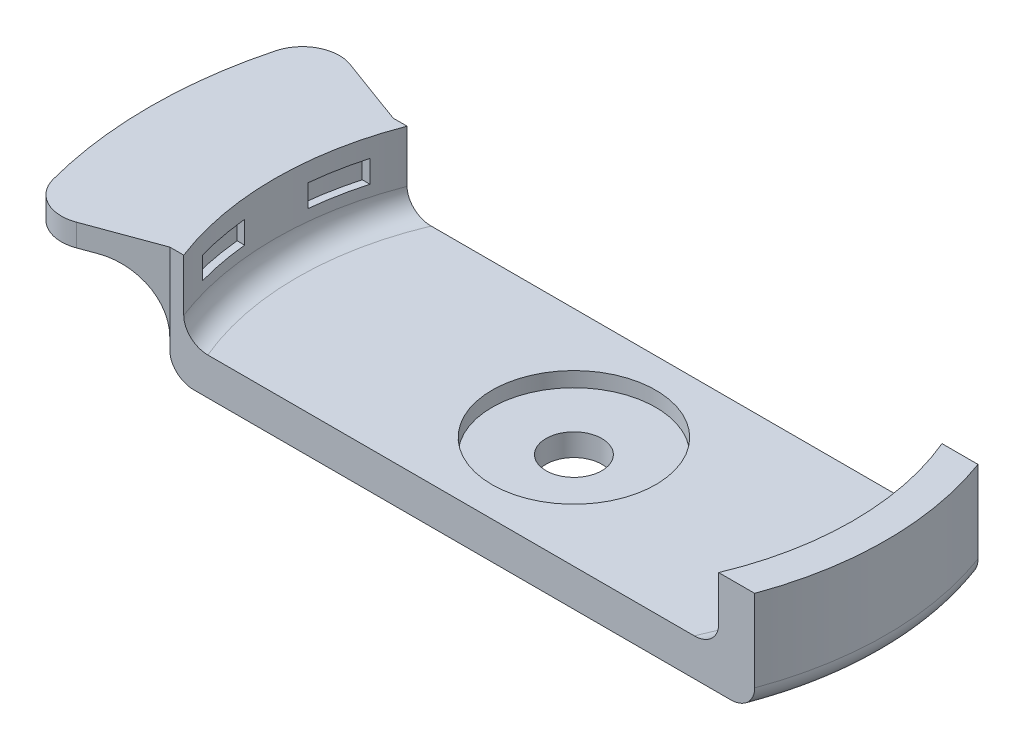
from build123d import *

# Parameters (mm, degrees)
BOSS_EXTRUDE1_DEPTH      = 8.5
CUT_EXTRUDE4_DEPTH       = 12
FILLET1_R                = 3
CUT_EXTRUDE5_DEPTH       = 46.354741112
CUT_EXTRUDE5_DEPTH_BACK  = 46.354741112
SKETCH6_W                = 4.541260622
SKETCH6_H                = 2
CUT_EXTRUDE6_START       = 1
CUT_EXTRUDE6_DEPTH       = 3
CUT_EXTRUDE7_REACH       = 47.355
CUT_EXTRUDE7_END_RADIUS  = 42.2
SKETCH8_W                = 25
SKETCH8_H                = 3
BOSS_EXTRUDE2_START      = 6.5
BOSS_EXTRUDE2_DEPTH      = 3
FILLET2_R                = 5
SKETCH10_R               = 11
CUT_EXTRUDE8_DEPTH       = 2
CUT_EXTRUDE9_REACH       = 63.124
SKETCH11_R               = 3.75
FILLET3_R                = 7.5
CUT_EXTRUDE10_DEPTH      = 61.534679882
CUT_EXTRUDE10_DEPTH_BACK = 61.534679882
SKETCH12_W               = 19.340558592
SKETCH12_H               = 3


# Read off the part's stored shape, not the designer's step: Cut-Extrude6
with BuildPart() as part:
    # Sketch1 → Boss-Extrude1 (new, symmetric)
    with BuildSketch(Plane(origin=(0, 0, 0), x_dir=(1, 0, 0), z_dir=(0, 1, 0))):
        with BuildLine():
            Line((-39.278701549, 15), (39.278701549, 15))
            ThreePointArc((39.278701549, 15), (41.95, 0), (39.278701549, -15))
            Line((39.278701549, -15), (-39.278701549, -15))
            ThreePointArc((-39.278701549, -15), (-41.95, 0), (-39.278701549, 15))
        make_face()
    extrude(amount=BOSS_EXTRUDE1_DEPTH, both=True)

    # Sketch5 → Cut-Extrude4 (cut)
    with BuildSketch(Plane(origin=(0, 8.5, 0), x_dir=(1, 0, 0), z_dir=(0, 1, 0))):
        with BuildLine():
            Line((-37.408739378, 15), (34.445827296, 15))
            ThreePointArc((34.445827296, 15), (37.45, 0), (34.445827296, -15))
            Line((34.445827296, -15), (-37.408739378, -15))
            ThreePointArc((-37.408739378, -15), (-40.2, 0), (-37.408739378, 15))
        make_face()
    extrude(amount=-CUT_EXTRUDE4_DEPTH, mode=Mode.SUBTRACT)

    # Fillet1
    fillet1_edges = [part.edges().sort_by_distance(p)[0] for p in [
        (-40.2, -3.5, 0),
        (37.45, -3.5, 0),
        (-41.95, -8.5, 0),
        (41.95, -8.5, 0),
    ]]
    fillet(fillet1_edges, radius=FILLET1_R)

    # Sketch6 → Cut-Extrude5 (cut, two sides: drawn at the far end of the back side and taken through both)
    with BuildSketch(Plane.XY.offset(-CUT_EXTRUDE5_DEPTH_BACK)):
        with Locations((-39.679369689, 7.5)):
            Rectangle(SKETCH6_W, SKETCH6_H)
    extrude(amount=CUT_EXTRUDE5_DEPTH + CUT_EXTRUDE5_DEPTH_BACK, mode=Mode.SUBTRACT)

    # Cut-Extrude6 outline → Cut-Extrude6 (cut)
    with BuildSketch(Plane(origin=(0, 0, 0), x_dir=(1, 0, 0), z_dir=(0, 1, 0)).offset(CUT_EXTRUDE6_START)):
        with BuildLine():
            ThreePointArc((-40.987968885, -4.25), (-40.485797555, -7.777069093), (-39.691352248, -11.25))
            Line((-39.691352248, -11.25), (-38.653798077, -11.25))
            ThreePointArc((-38.653798077, -11.25), (-39.468108328, -7.778438147), (-39.982857905, -4.25))
            Line((-39.982857905, -4.25), (-40.987968885, -4.25))
        make_face()
        with BuildLine():
            Line((-40.987968885, 4.25), (-39.982857905, 4.25))
            ThreePointArc((-39.982857905, 4.25), (-39.468108328, 7.778438147), (-38.653798077, 11.25))
            Line((-38.653798077, 11.25), (-39.691352248, 11.25))
            ThreePointArc((-39.691352248, 11.25), (-40.485797555, 7.777069093), (-40.987968885, 4.25))
        make_face()
    extrude(amount=CUT_EXTRUDE6_DEPTH, mode=Mode.SUBTRACT)

    # Cut-Extrude7: up to this cylinder (the profile starts inside it)
    cut_extrude7_end = Plane(origin=(-1.5, 0.5, 0), z_dir=(0, -1, 0)) * Cylinder(CUT_EXTRUDE7_END_RADIUS, 180.11, mode=Mode.PRIVATE)
    # Sketch8 → Cut-Extrude7 (cut, up to the surface)
    with BuildSketch(Plane(origin=(0, 0, 0), x_dir=(0, 0, -1), z_dir=(1, 0, 0)), mode=Mode.PRIVATE) as cut_extrude7_sk1:
        with Locations((0, 0.5)):
            Rectangle(SKETCH8_W, SKETCH8_H)
    cut_extrude7_tool1 = extrude(cut_extrude7_sk1.sketch, amount=CUT_EXTRUDE7_REACH, mode=Mode.PRIVATE) & cut_extrude7_end
    add(cut_extrude7_tool1.solids().sort_by_distance((0, 0.5, 0))[0], mode=Mode.SUBTRACT)

    # Sketch9 → Boss-Extrude2 (add)
    with BuildSketch(Plane(origin=(0, 0, 0), x_dir=(1, 0, 0), z_dir=(0, 1, 0)).offset(BOSS_EXTRUDE2_START)):
        with BuildLine():
            Line((-53.356504155, 20.178365938), (-39.278701549, 15))
            ThreePointArc((-39.278701549, 15), (-41.95, 0), (-39.278701549, -15))
            Line((-39.278701549, -15), (-53.356504155, -20.178365938))
            ThreePointArc((-53.356504155, -20.178365938), (-56.95, 0), (-53.356504155, 20.178365938))
        make_face()
    extrude(amount=-BOSS_EXTRUDE2_DEPTH)

    # Fillet2
    fillet2_edges = [part.edges().sort_by_distance(p)[0] for p in [
        (-53.356504155, 5, 20.178365938),
        (-53.356504155, 5, -20.178365938),
    ]]
    fillet(fillet2_edges, radius=FILLET2_R)

    # Sketch10 → Cut-Extrude8 (cut)
    with BuildSketch(Plane(origin=(0, -3.5, 0), x_dir=(1, 0, 0), z_dir=(0, 1, 0))):
        with Locations(Location((0, 0, 0), (0, 0, 270))):
            Circle(SKETCH10_R)
    extrude(amount=-CUT_EXTRUDE8_DEPTH, mode=Mode.SUBTRACT)

    # Sketch11 → Cut-Extrude9 (cut, up to next)
    with BuildSketch(Plane(origin=(0, -3.5, 0), x_dir=(1, 0, 0), z_dir=(0, 1, 0)), mode=Mode.PRIVATE) as cut_extrude9_sk1:
        with Locations(Location((0, 0, 0), (0, 0, 270))):
            Circle(SKETCH11_R)
    cut_extrude9_tool1 = extrude(cut_extrude9_sk1.sketch, amount=-CUT_EXTRUDE9_REACH, mode=Mode.PRIVATE) & part.part
    add(cut_extrude9_tool1.solids().sort_by_distance((0, -3.5, 0))[0], mode=Mode.SUBTRACT)

    # Fillet3
    fillet3_edges = [part.edges().sort_by_distance(p)[0] for p in [
        (-41.95, 3.5, 0),
    ]]
    fillet(fillet3_edges, radius=FILLET3_R)

    # Sketch12 → Cut-Extrude10 (cut, two sides: drawn at the far end of the back side and taken through both)
    with BuildSketch(Plane.XY.offset(-CUT_EXTRUDE10_DEPTH_BACK)):
        with Locations((38.128696485, 7)):
            Rectangle(SKETCH12_W, SKETCH12_H)
    extrude(amount=CUT_EXTRUDE10_DEPTH + CUT_EXTRUDE10_DEPTH_BACK, mode=Mode.SUBTRACT)


solid = part.part
